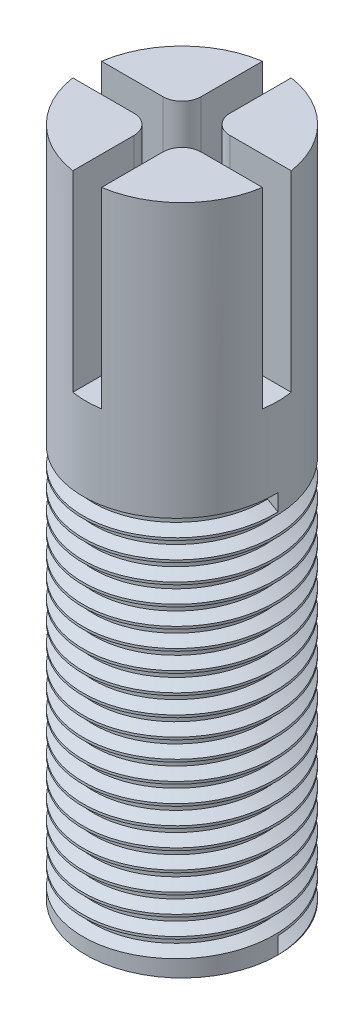
from build123d import *
from build123d.topology import SkipClean

# Parameters (mm, degrees)
CROQUIS1_R              = 5
SALIENTE_EXTRUIR1_DEPTH = 35
CORTAR_EXTRUIR1_DEPTH   = 10
REDONDEO1_R             = 1
ROSCA1_PITCH            = 1


with BuildPart() as part:
    # Croquis1 → Saliente-Extruir1 (new body)
    with BuildSketch(Plane(origin=(0, 0, 0), x_dir=(1, 0, 0), z_dir=(0, 1, 0))):
        with Locations(Location((0, 0, 0), (0, 0, 270))):
            Circle(CROQUIS1_R)
    extrude(amount=SALIENTE_EXTRUIR1_DEPTH)

    # Croquis2 → Cortar-Extruir1 (cut)
    with BuildSketch(Plane(origin=(0, 35, 0), x_dir=(1, 0, 0), z_dir=(0, 1, 0))):
        Polygon((0.75, 0.75), (5.939644968, 0.75), (5.939644968, -0.75), (0.75, -0.75), (0.75, -5.678934082), (-0.75, -5.678934082), (-0.75, -0.75), (-6.550621745, -0.75), (-6.550621745, 0.75), (-0.75, 0.75), (-0.75, 5.957875238), (0.75, 5.957875238), align=None)
    extrude(amount=-CORTAR_EXTRUIR1_DEPTH, mode=Mode.SUBTRACT)

    # Redondeo1
    redondeo1_edges = [part.edges().sort_by_distance(p)[0] for p in [
        (0.75, 30, -0.75),
        (0.75, 30, 0.75),
        (-0.75, 30, 0.75),
        (-0.75, 30, -0.75),
    ]]
    fillet(redondeo1_edges, radius=REDONDEO1_R)

    # Rosca1: the profile of Perfil de rosca1 profile screwed along a right-hand helix of 20 turns, 8 arcs to a turn; built about Z, then put on its axis
    with SkipClean():  # the faces are left unmerged after this step: merging them gives an invalid solid
        rosca1_z = Axis((0, 0, 0), (0, 0, 1))
        rosca1_corners = [(5.0003, 0, -0.000173205), (5.0003, 0, 0.875173202), (4.458734125, 0, 0.562499999), (4.458734125, 0, 0.312499999)]
        with BuildLine(mode=Mode.PRIVATE) as rosca1_profile:
            Line(rosca1_corners[0], rosca1_corners[1])
            Line(rosca1_corners[1], rosca1_corners[2])
            Line(rosca1_corners[2], rosca1_corners[3])
            Line(rosca1_corners[3], rosca1_corners[0])
        rosca1_cap = Face(rosca1_profile.wire())
        rosca1_turn_angles = [0, 22.5, 45, 67.5, 90, 112.5, 135, 157.5, 180, 202.5, 225, 247.5, 270, 292.5, 315, 337.5, 360]
        rosca1_turn_weights = [1, 0.9238795325112867, 1, 0.9238795325112867, 1, 0.9238795325112867, 1, 0.9238795325112867, 1, 0.9238795325112867, 1, 0.9238795325112867, 1, 0.9238795325112867, 1, 0.9238795325112867, 1]
        rosca1_turn_rails = [Edge.make_bspline([Vector(p[0], p[1], 0).rotate(rosca1_z, rosca1_turn_angles[k]) / rosca1_turn_weights[k] + Vector(0, 0, p[2] + ROSCA1_PITCH * rosca1_turn_angles[k] / 360) for k in range(17)], [0, 0, 0, 1, 1, 2, 2, 3, 3, 4, 4, 5, 5, 6, 6, 7, 7, 8, 8, 8], 2, rosca1_turn_weights) for p in rosca1_corners]
        rosca1_turn_sides = [Face.make_surface_from_curves(rosca1_turn_rails[p[0]], rosca1_turn_rails[p[1]]) for p in [(0, 1), (1, 2), (2, 3), (3, 0)]]
        rosca1 = Plane(origin=(0, 0, 0), x_dir=(1, 0, 0), z_dir=(0, 1, 0)) * Solid(Shell([*[p.moved(Location((0, 0, ROSCA1_PITCH * i))) for i in range(20) for p in rosca1_turn_sides], rosca1_cap, rosca1_cap.rotate(rosca1_z, 7200).moved(Location((0, 0, ROSCA1_PITCH * 7200 / 360)))]))
        add(rosca1, mode=Mode.SUBTRACT)


solid = part.part
